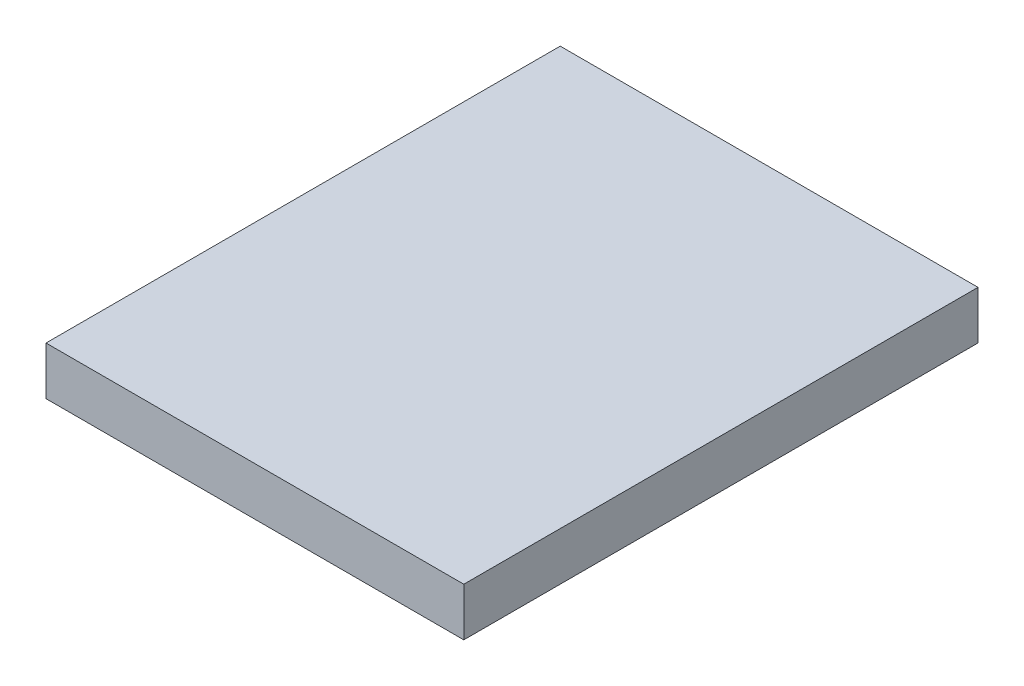
from build123d import *

# Parameters (mm, degrees)
SKETCH1_W           = 165.1
SKETCH1_H           = 203.2
BOSS_EXTRUDE1_DEPTH = 19.05


with BuildPart() as part:
    # Sketch1 → Boss-Extrude1 (new body)
    with BuildSketch(Plane(origin=(0, 0, 0), x_dir=(1, 0, 0), z_dir=(0, 1, 0))):
        with Locations((9.361397209, -52.256716183)):
            Rectangle(SKETCH1_W, SKETCH1_H)
    extrude(amount=BOSS_EXTRUDE1_DEPTH)


solid = part.part
